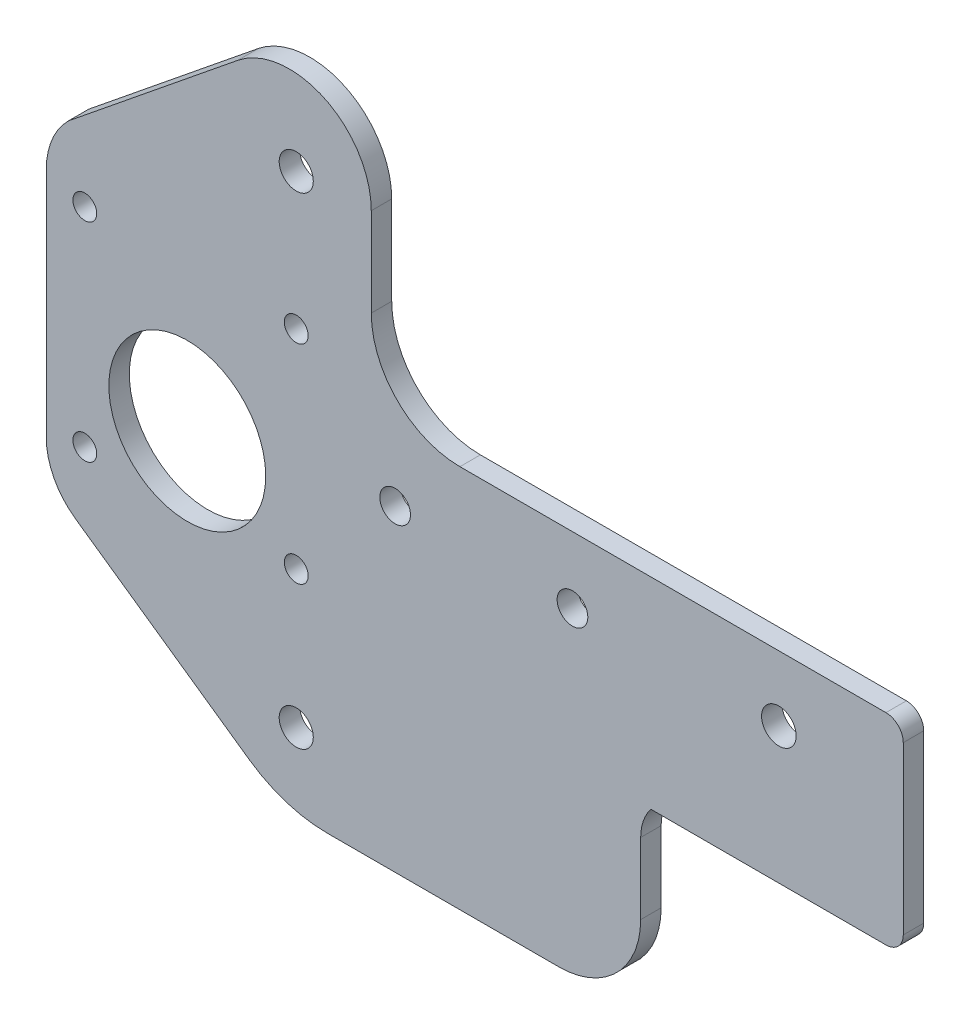
from build123d import *

# Parameters (mm, degrees)
SKETCH1_R           = 2.54
SKETCH1_R_2         = 2.25
SKETCH1_R_3         = 1.75
SKETCH1_R_4         = 2.5
SKETCH1_R_5         = 11.5
BOSS_EXTRUDE1_DEPTH = 3
FILLET2_R           = 2.54


with BuildPart() as part:
    # Sketch1 → Boss-Extrude1 (new body)
    with BuildSketch(Plane.XY):
        with BuildLine():
            Line((0, 0), (0, -29.5))
            Line((0, -29.5), (-37, -29.5))
            ThreePointArc((-37, -29.5), (-38.114378278, -31.538839171), (-38.5, -33.830127019))
            Line((-38.5, -33.830127019), (-38.5, -44.26209895))
            ThreePointArc((-38.5, -44.26209895), (-42.014718626, -52.747380324), (-50.5, -56.26209895))
            Line((-50.5, -56.26209895), (-84.414235636, -56.26209895))
            ThreePointArc((-84.414235636, -56.26209895), (-90.428351627, -55.336437965), (-95.885764364, -52.645139836))
            Line((-95.885764364, -52.645139836), (-121.385764364, -34.789847611))
            ThreePointArc((-121.385764364, -34.789847611), (-124.520108332, -31.215813301), (-125.65, -26.598327168))
            Line((-125.65, -26.598327168), (-125.65, 7.401672832))
            ThreePointArc((-125.65, 7.401672832), (-124.8106021, 11.616191188), (-122.420515459, 15.187499024))
            Line((-122.420515459, 15.187499024), (-97.551844693, 35.325751537))
            ThreePointArc((-97.551844693, 35.325751537), (-84.833866838, 36.831023412), (-78, 26))
            Line((-78, 26), (-78, 13))
            ThreePointArc((-78, 13), (-74.192388155, 3.807611845), (-65, 0))
            Line((-65, 0), (0, 0))
        make_face()
        with Locations((-18.237, -9.552)):
            Circle(SKETCH1_R, mode=Mode.SUBTRACT)
        with Locations((-48.5, -9.75)):
            Circle(SKETCH1_R_2, mode=Mode.SUBTRACT)
        with Locations((-74.5, -9.75)):
            Circle(SKETCH1_R_2, mode=Mode.SUBTRACT)
        with Locations((-89, 5.5)):
            Circle(SKETCH1_R_3, mode=Mode.SUBTRACT)
        with Locations((-89, 25.5)):
            Circle(SKETCH1_R_4, mode=Mode.SUBTRACT)
        with Locations((-89, -25)):
            Circle(SKETCH1_R_3, mode=Mode.SUBTRACT)
        with Locations((-89, -45.112)):
            Circle(SKETCH1_R_4, mode=Mode.SUBTRACT)
        with Locations((-104.975027079, -15.450324944)):
            Circle(SKETCH1_R_5, mode=Mode.SUBTRACT)
        with Locations((-120, 5.5)):
            Circle(SKETCH1_R_3, mode=Mode.SUBTRACT)
        with Locations((-120, -25)):
            Circle(SKETCH1_R_3, mode=Mode.SUBTRACT)
    extrude(amount=BOSS_EXTRUDE1_DEPTH)

    # Fillet2
    fillet2_edges = [part.edges().sort_by_distance(p)[0] for p in [
        (0, 0, 1.5),
        (0, -29.5, 1.5),
    ]]
    fillet(fillet2_edges, radius=FILLET2_R)


solid = part.part
